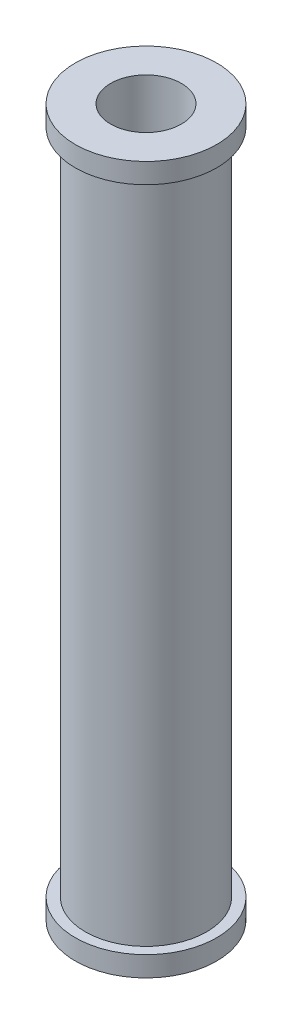
from build123d import *

# Parameters (mm, degrees)
SKETCH3_R           = 3
SKETCH3_R_2         = 1.75
BOSS_EXTRUDE1_DEPTH = 33
SKETCH21_R          = 3.5
BOSS_EXTRUDE2_DEPTH = 1
CUT_EXTRUDE6_START  = -8.3
SKETCH29_R          = 1.75
CUT_EXTRUDE6_DEPTH  = 8.3
BOSS_EXTRUDE5_START = 1
SKETCH33_R          = 3.5
BOSS_EXTRUDE5_DEPTH = 1
SKETCH35_R          = 1.75
CUT_EXTRUDE8_DEPTH  = 1.3


with BuildPart() as part:
    # Sketch3 → Boss-Extrude1 (new body)
    with BuildSketch(Plane(origin=(0, 0, 0), x_dir=(1, 0, 0), z_dir=(0, 1, 0))):
        Circle(SKETCH3_R)
        Circle(SKETCH3_R_2, mode=Mode.SUBTRACT)
    extrude(amount=BOSS_EXTRUDE1_DEPTH)

    # Sketch21 → Boss-Extrude2 (add)
    with BuildSketch(Plane(origin=(0, 33, 0), x_dir=(1, 0, 0), z_dir=(0, 1, 0))):
        Circle(SKETCH21_R)
    extrude(amount=BOSS_EXTRUDE2_DEPTH)

    # Sketch29 → Cut-Extrude6 (cut)
    with BuildSketch(Plane(origin=(0, 34, 0), x_dir=(1, 0, 0), z_dir=(0, 1, 0)).offset(CUT_EXTRUDE6_START)):
        Circle(SKETCH29_R)
    extrude(amount=CUT_EXTRUDE6_DEPTH, mode=Mode.SUBTRACT)

    # Sketch33 → Boss-Extrude5 (add)
    with BuildSketch(Plane.XZ.offset(BOSS_EXTRUDE5_START)):
        Circle(SKETCH33_R)
    extrude(amount=-BOSS_EXTRUDE5_DEPTH)

    # Sketch35 → Cut-Extrude8 (cut)
    with BuildSketch(Plane.XZ.offset(1)):
        Circle(SKETCH35_R)
    extrude(amount=-CUT_EXTRUDE8_DEPTH, mode=Mode.SUBTRACT)


solid = part.part
